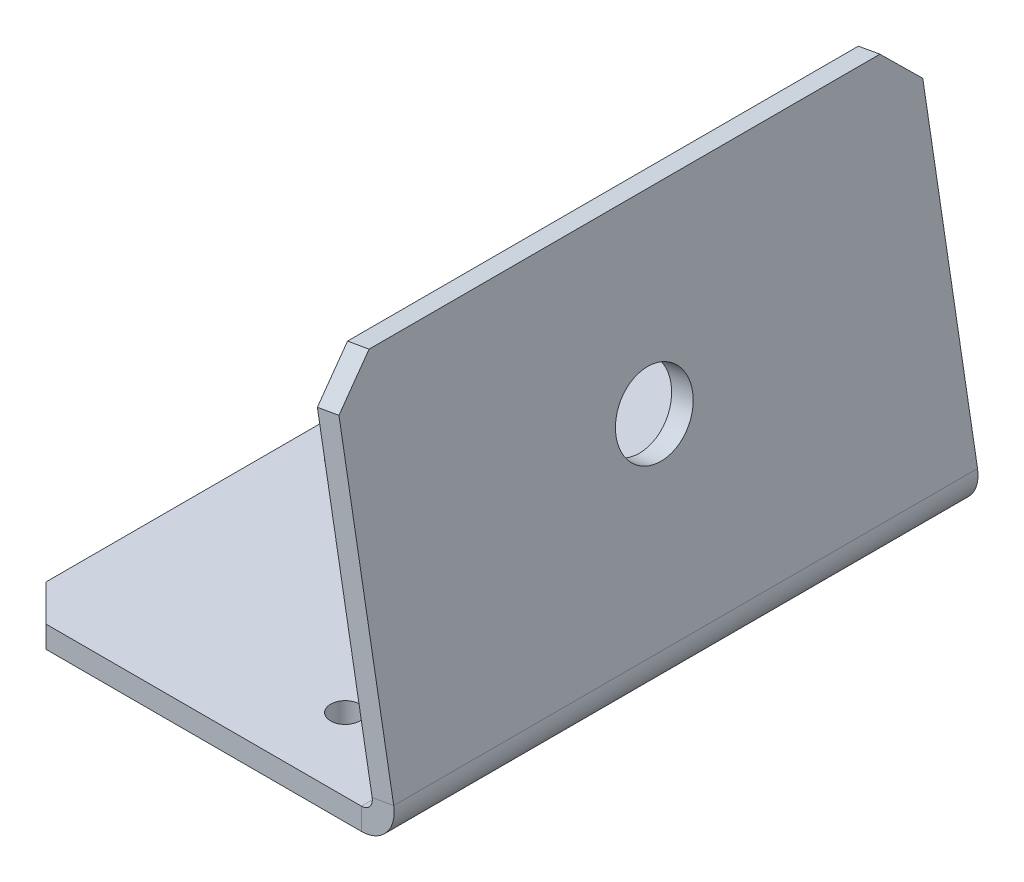
from build123d import *

# Parameters (mm, degrees)
SKETCH1_W                    = 50
SKETCH1_H                    = 80
BASE_FLANGE1_DEPTH           = 3
EDGE_FLANGE1_STRIP_CUT_DEPTH = 80
EDGE_FLANGE1_DEPTH           = 80
CHAMFER1_SIZE                = 5
SKETCH7_R                    = 5.25
CUT_EXTRUDE1_DEPTH           = 10
CUT_EXTRUDE2_REACH           = 73.776
SKETCH8_R                    = 2


# Sheet-metal steps are written as plain solids
with BuildPart() as part:
    # Sketch1 → Base-Flange1 (new body)
    with BuildSketch(Plane(origin=(0, 0, 0), x_dir=(1, 0, 0), z_dir=(0, 1, 0))):
        Rectangle(SKETCH1_W, SKETCH1_H)
    extrude(amount=-BASE_FLANGE1_DEPTH)

    # Edge-Flange1 strip (across the edge) → Edge-Flange1 strip cut (cut)
    with BuildSketch(Plane(origin=(25, 0, 40), x_dir=(-0.9848077530122087, -0.17364817766692717, 0), z_dir=(0, 0, -1))):
        Polygon((-15.323305866, -5.748192093), (2.2814168, -2.6440045), (1.760472267, 0.310418759), (-15.844250399, -2.793768834), align=None)
    extrude(amount=EDGE_FLANGE1_STRIP_CUT_DEPTH, mode=Mode.SUBTRACT)

    # Edge-Flange1 section (across the edge) → Edge-Flange1 (add)
    with BuildSketch(Plane(origin=(25, 0, 40), x_dir=(-0.9848077530122087, -0.17364817766692717, 0), z_dir=(0, 0, -1))):
        with BuildLine():
            Line((-3, 1.787630389), (-3, 50))
            Line((-3, 50), (0, 50))
            Line((0, 50), (0, 1.787630389))
            ThreePointArc((0, 1.787630389), (0.535818585, 0.638563724), (1.760472267, 0.310418759))
            Line((1.760472267, 0.310418759), (2.2814168, -2.6440045))
            ThreePointArc((2.2814168, -2.6440045), (-1.392544244, -1.659569605), (-3, 1.787630389))
        make_face()
    extrude(amount=EDGE_FLANGE1_DEPTH)

    # Chamfer1
    chamfer1_edges = [part.edges().sort_by_distance(p)[0] for p in [
        (17.794802746, 49.500859917, 40),
        (17.794802746, 49.500859917, -40),
        (-25, -1.5, 40),
        (-25, -1.5, -40),
    ]]
    chamfer(chamfer1_edges, length=CHAMFER1_SIZE)

    # Sketch7 → Cut-Extrude1 (cut)
    with BuildSketch(Plane(origin=(27.200581019, 4.796196325, 0), x_dir=(0, 0, -1), z_dir=(0.9848077530122087, 0.1736481776669272, 0))):
        with Locations(Location((0, 22.158795558, 0), (0, 0, 90))):
            Circle(SKETCH7_R)
    extrude(amount=-CUT_EXTRUDE1_DEPTH, mode=Mode.SUBTRACT)

    # Sketch8 → Cut-Extrude2 (cut, up to next)
    with BuildSketch(Plane.XZ.offset(3), mode=Mode.PRIVATE) as cut_extrude2_sk1:
        with Locations(Location((-19, 0, 0), (0, 0, 270))):
            Circle(SKETCH8_R)
    cut_extrude2_tool1 = extrude(cut_extrude2_sk1.sketch, amount=-CUT_EXTRUDE2_REACH, mode=Mode.PRIVATE) & part.part
    # Sketch8 → Cut-Extrude2 (cut, up to next)
    with BuildSketch(Plane.XZ.offset(3), mode=Mode.PRIVATE) as cut_extrude2_sk2:
        with Locations(Location((11, 30, 0), (0, 0, 270))):
            Circle(SKETCH8_R)
    cut_extrude2_tool2 = extrude(cut_extrude2_sk2.sketch, amount=-CUT_EXTRUDE2_REACH, mode=Mode.PRIVATE) & part.part
    # Sketch8 → Cut-Extrude2 (cut, up to next)
    with BuildSketch(Plane.XZ.offset(3), mode=Mode.PRIVATE) as cut_extrude2_sk3:
        with Locations(Location((11, -30, 0), (0, 0, 270))):
            Circle(SKETCH8_R)
    cut_extrude2_tool3 = extrude(cut_extrude2_sk3.sketch, amount=-CUT_EXTRUDE2_REACH, mode=Mode.PRIVATE) & part.part
    add(cut_extrude2_tool1.solids().sort_by_distance((-19, -3, 0))[0], mode=Mode.SUBTRACT)
    add(cut_extrude2_tool2.solids().sort_by_distance((11, -3, 30))[0], mode=Mode.SUBTRACT)
    add(cut_extrude2_tool3.solids().sort_by_distance((11, -3, -30))[0], mode=Mode.SUBTRACT)


solid = part.part
